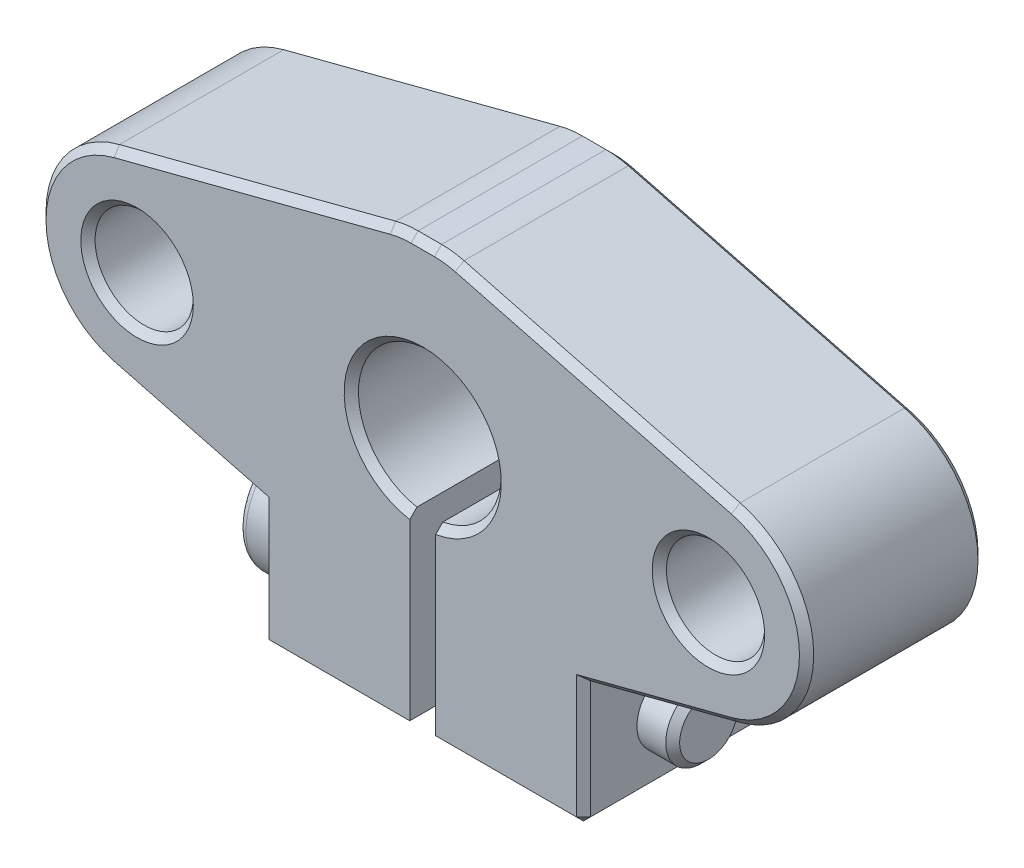
from build123d import *

# Parameters (mm, degrees)
SKETCH_2_R          = 2.75
EXTRUDE_1_DEPTH     = 10
FILLET_1_R          = 5
CHAMFER_1_SIZE      = 0.4
CUT_EXTRUDE_3_REACH = 29.794
SKETCH_4_R          = 2
CUT_EXTRUDE_1_DEPTH = 36.220732531
FILLET_2_R          = 0.4
CUT_EXTRUDE_4_DEPTH = 2.5
CHAMFER_2_SIZE      = 0.4


with BuildPart() as part:
    # Эскиз2 → Бобышка-Вытянуть1 (new body)
    with BuildSketch(Plane.XY):
        with BuildLine():
            Line((17.382284837, 5.323465848), (1.29758483, 9.5))
            Line((1.29758483, 9.5), (-1.29758483, 9.5))
            Line((-1.29758483, 9.5), (-17.382284837, 5.323465848))
            ThreePointArc((-17.382284837, 5.323465848), (-21.5, 0), (-17.382284837, -5.323465848))
            Line((-17.382284837, -5.323465848), (-9, -7.5))
            Line((-9, -7.5), (-9, -14.5))
            Line((-9, -14.5), (-0.725, -14.5))
            Line((-0.725, -14.5), (-0.725, -3.933748213))
            ThreePointArc((-0.725, -3.933748213), (0, 4), (0.725, -3.933748213))
            Line((0.725, -3.933748213), (0.725, -14.5))
            Line((0.725, -14.5), (9, -14.5))
            Line((9, -14.5), (9, -7.5))
            Line((9, -7.5), (17.382284837, -5.323465848))
            ThreePointArc((17.382284837, -5.323465848), (21.5, 0), (17.382284837, 5.323465848))
        make_face()
        with Locations((16, 0)):
            Circle(SKETCH_2_R, mode=Mode.SUBTRACT)
        with Locations((-16, 0)):
            Circle(SKETCH_2_R, mode=Mode.SUBTRACT)
    extrude(amount=EXTRUDE_1_DEPTH)

    # Скругление1
    fillet_1_edges = [part.edges().sort_by_distance(p)[0] for p in [
        (-1.29758483, 9.5, 5),
        (1.29758483, 9.5, 5),
    ]]
    fillet(fillet_1_edges, radius=FILLET_1_R)

    # Фаска1
    chamfer_1_edges = [part.edges().sort_by_distance(p)[0] for p in [
        (-18.75, 0, 10),
        (13.25, 0, 10),
        (0.725, -14.5, 5),
        (9, -14.5, 5),
        (-9, -14.5, 5),
        (-21.5, 0, 0),
        (-13.191142418, -6.411732924, 0),
        (-4.8625, -14.5, 0),
        (-9.6489665, 7.331490127, 0),
        (0, 9.5, 0),
        (9.6489665, 7.331490127, 0),
        (21.5, 0, 0),
        (13.191142418, -6.411732924, 0),
        (4.8625, -14.5, 0),
        (0, 4, 0),
        (-0.725, -14.5, 5),
        (0, 9.5, 10),
        (9.6489665, 7.331490127, 10),
        (21.5, 0, 10),
        (13.191142418, -6.411732924, 10),
        (9, -11, 10),
        (4.8625, -14.5, 10),
        (0, 4, 10),
        (-4.8625, -14.5, 10),
        (-13.191142418, -6.411732924, 10),
        (-21.5, 0, 10),
        (-9.6489665, 7.331490127, 10),
        (-1.292440127, 9.459716324, 0),
        (1.292440127, 9.459716324, 0),
        (1.292440127, 9.459716324, 10),
        (-1.292440127, 9.459716324, 10),
        (-9, -11, 10),
        (-18.75, 0, 0),
        (13.25, 0, 0),
    ]]
    chamfer(chamfer_1_edges, length=CHAMFER_1_SIZE)

    # Эскиз6 → Вырез-Вытянуть3 (cut, up to next)
    with BuildSketch(Plane.XY.offset(10), mode=Mode.PRIVATE) as cut_extrude_3_sk1:
        Polygon((-8.6, -11), (-10.253715484, -10.04522692), (-10.253715484, -11.95477308), align=None)
    cut_extrude_3_tool1 = extrude(cut_extrude_3_sk1.sketch, amount=-CUT_EXTRUDE_3_REACH, mode=Mode.PRIVATE) & part.part
    add(cut_extrude_3_tool1.solids().sort_by_distance((-9.702477, -11, 10))[0], mode=Mode.SUBTRACT)

    # Эскиз4 → Вырез-Вытянуть1 (cut, through all)
    with BuildSketch(Plane.ZY.offset(9)):
        with Locations((5, -11)):
            Circle(SKETCH_4_R)
    extrude(amount=-CUT_EXTRUDE_1_DEPTH, mode=Mode.SUBTRACT)


with BuildPart() as body_2:
    # Эскиз7 → Повернуть1 (revolve)
    with BuildSketch(Plane.XY.offset(5)):
        Polygon((-11.8, -11), (-11.8, -7.5), (-9, -7.5), (-9, -9), (10.61, -9), (11, -9.39), (11, -11), align=None)
    revolve(axis=Axis((11, -11, 5), (-1, 0, 0)))

    # Скругление2
    fillet_2_edges = [body_2.edges().sort_by_distance(p)[0] for p in [
        (-11.8, -14.5, 5),
    ]]
    fillet(fillet_2_edges, radius=FILLET_2_R)

    # Эскиз8 → Вырез-Вытянуть4 (cut)
    with BuildSketch(Plane.ZY.offset(11.8)):
        Polygon((5, -9.267949192), (3.5, -10.133974596), (3.5, -11.866025404), (5, -12.732050808), (6.5, -11.866025404), (6.5, -10.133974596), align=None)
    extrude(amount=-CUT_EXTRUDE_4_DEPTH, mode=Mode.SUBTRACT)

    # Фаска2
    chamfer_2_edges = [body_2.edges().sort_by_distance(p)[0] for p in [
        (-11.8, -9.700961894, 4.25),
        (-11.8, -11, 3.5),
        (-11.8, -12.299038106, 4.25),
        (-11.8, -12.299038106, 5.75),
        (-11.8, -11, 6.5),
        (-11.8, -9.700961894, 5.75),
        (-9.3, -11, 6.5),
        (-9.3, -12.299038106, 5.75),
        (-9.3, -12.299038106, 4.25),
        (-9.3, -11, 3.5),
        (-9.3, -9.700961894, 4.25),
        (-9.3, -9.700961894, 5.75),
    ]]
    chamfer(chamfer_2_edges, length=CHAMFER_2_SIZE)


solid = Compound([part.part, body_2.part])
